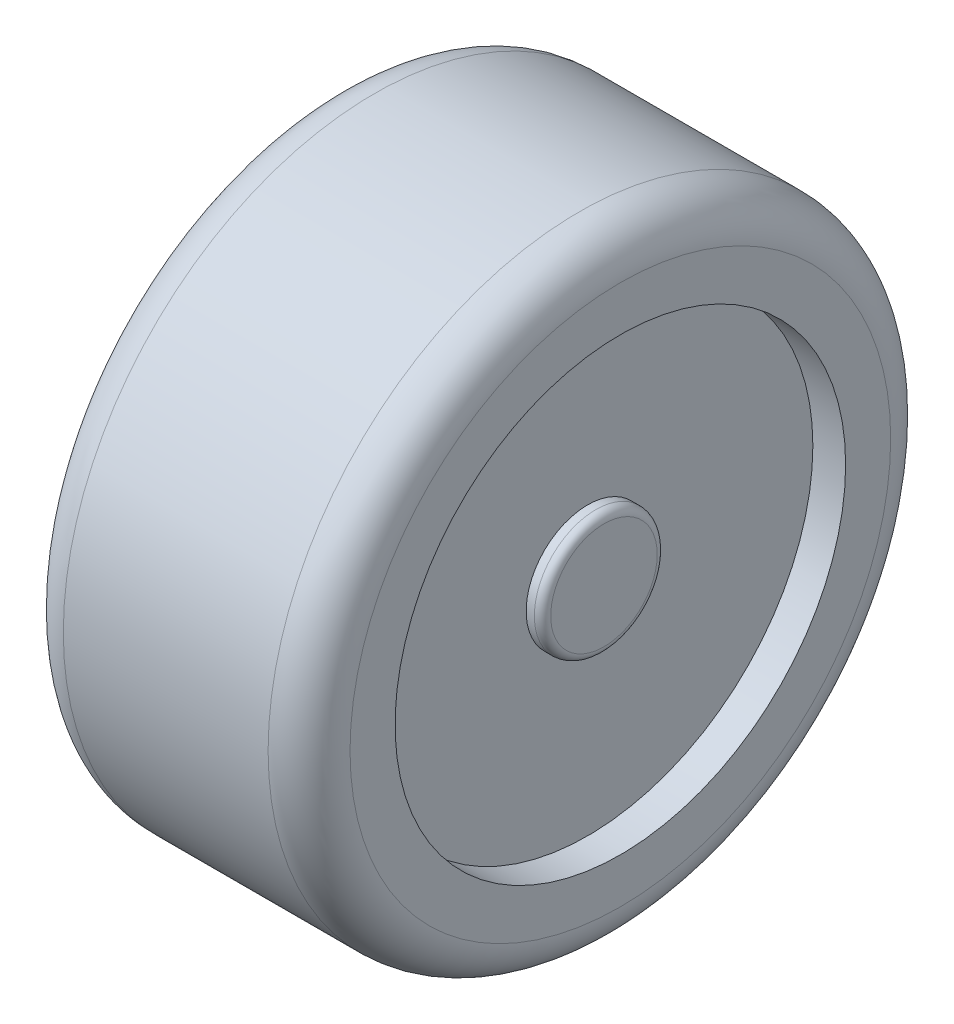
from build123d import *

# Parameters (mm, degrees)
BOSS_EXTRUDE1_DEPTH      = 5
BOSS_EXTRUDE1_DEPTH_BACK = 30
SKETCH1_R                = 38
SKETCH1_R_2              = 27.5
BOSS_EXTRUDE2_DEPTH      = 3
BOSS_EXTRUDE2_DEPTH_BACK = 7
SKETCH1_3_R              = 7.5
SKETCH1_4_R              = 3.5
BOSS_EXTRUDE3_DEPTH      = 50
SKETCH1_5_R              = 27.5
SKETCH1_5_R_2            = 7.5
BOSS_EXTRUDE4_DEPTH      = 1
FILLET1_R                = 5
FILLET2_R                = 1


with BuildPart() as part:
    # Sketch1 → Boss-Extrude1 (new, two sides: drawn at the far end of the back side and taken through both)
    with BuildSketch(Plane(origin=(0, 0, 0), x_dir=(0, 0, -1), z_dir=(1, 0, 0)).offset(-BOSS_EXTRUDE1_DEPTH_BACK)):
        Circle(SKETCH1_R)
        Circle(SKETCH1_R_2, mode=Mode.SUBTRACT)
    extrude(amount=BOSS_EXTRUDE1_DEPTH + BOSS_EXTRUDE1_DEPTH_BACK)



with BuildPart() as body_2:
    # Sketch1<3> → Boss-Extrude2 (new, two sides: drawn at the far end of the back side and taken through both)
    with BuildSketch(Plane(origin=(0, 0, 0), x_dir=(0, 0, -1), z_dir=(1, 0, 0)).offset(-BOSS_EXTRUDE2_DEPTH_BACK)):
        Circle(SKETCH1_3_R)
    extrude(amount=BOSS_EXTRUDE2_DEPTH + BOSS_EXTRUDE2_DEPTH_BACK)

    # Sketch1<4> → Boss-Extrude3 (add)
    with BuildSketch(Plane(origin=(0, 0, 0), x_dir=(0, 0, -1), z_dir=(1, 0, 0))):
        Circle(SKETCH1_4_R)
    extrude(amount=-BOSS_EXTRUDE3_DEPTH)


with BuildPart() as part_1:
    add(part.part)

    add(body_2.part)  # Boss-Extrude4 merges body 2
    # Sketch1<5> → Boss-Extrude4 (add, symmetric)
    with BuildSketch(Plane(origin=(0, 0, 0), x_dir=(0, 0, -1), z_dir=(1, 0, 0))):
        Circle(SKETCH1_5_R)
        Circle(SKETCH1_5_R_2, mode=Mode.SUBTRACT)
    extrude(amount=BOSS_EXTRUDE4_DEPTH, both=True)

    # Fillet1
    fillet1_edges = [part_1.edges().sort_by_distance(p)[0] for p in [
        (5, 0, 38),
        (-30, 0, 38),
    ]]
    fillet(fillet1_edges, radius=FILLET1_R - 0.0001)  # a hair under: the kernel refuses the full size

    # Fillet2
    fillet2_edges = [part_1.edges().sort_by_distance(p)[0] for p in [
        (3, 0, 7.5),
    ]]
    fillet(fillet2_edges, radius=FILLET2_R)


solid = part_1.part
